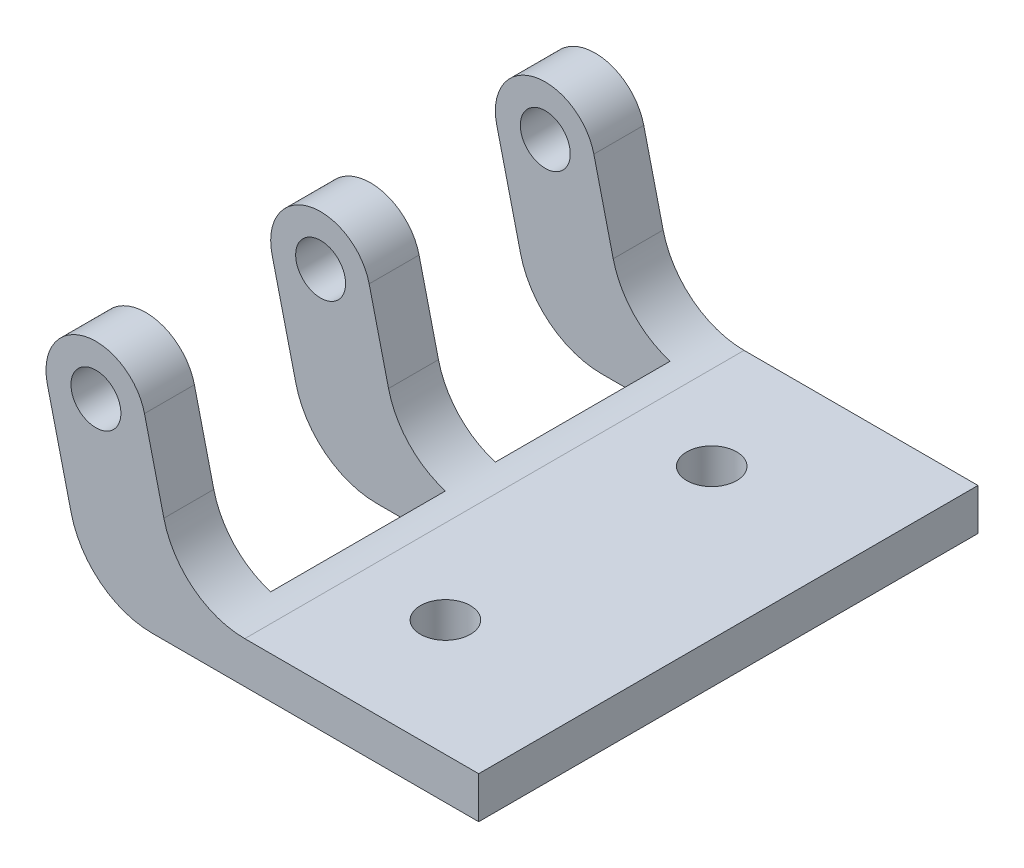
from build123d import *

# Parameters (mm, degrees)
ESBO_O1_R                  = 1.5
RESSALTO_EXTRUS_O1_DEPTH   = 30
FILETE1_R                  = 5
CORTE_EXTRUS_O1_DEPTH      = 37.193922142
CORTE_EXTRUS_O1_DEPTH_BACK = 37.193922142
ESBO_O2_R                  = 1.5
ESBO_O2_W                  = 10.5
ESBO_O2_H                  = 10.5


with BuildPart() as part:
    # Esboço1 → Ressalto-extrusão1 (new body)
    with BuildSketch(Plane.XY):
        with BuildLine():
            Line((-9, 0), (9, 0))
            Line((9, 0), (9, -2.5))
            Line((9, -2.5), (-14.571038018, -2.5))
            Line((-14.571038018, -2.5), (-16.91755647, 7.301527206))
            ThreePointArc((-16.91755647, 7.301527206), (-14.698472794, 10.91755647), (-11.08244353, 8.698472794))
            Line((-11.08244353, 8.698472794), (-9, 0))
        make_face()
        with Locations((-14, 8)):
            Circle(ESBO_O1_R, mode=Mode.SUBTRACT)
    extrude(amount=RESSALTO_EXTRUS_O1_DEPTH)

    # Filete1
    filete1_edges = [part.edges().sort_by_distance(p)[0] for p in [
        (-14.571038018, -2.5, 15),
        (-9, 0, 15),
    ]]
    fillet(filete1_edges, radius=FILETE1_R)

    # Esboço2 → Corte-extrusão1 (cut, two sides: drawn at the far end of the back side and taken through both)
    with BuildSketch(Plane(origin=(0, 0, 0), x_dir=(1, 0, 0), z_dir=(0, 1, 0)).offset(-CORTE_EXTRUS_O1_DEPTH_BACK)):
        with Locations((0, -7)):
            Circle(ESBO_O2_R)
        with Locations((0, -23)):
            Circle(ESBO_O2_R)
        with Locations((-11.75, -8.25)):
            Rectangle(ESBO_O2_W, ESBO_O2_H)
        with Locations((-11.75, -21.75)):
            Rectangle(ESBO_O2_W, ESBO_O2_H)
    extrude(amount=CORTE_EXTRUS_O1_DEPTH + CORTE_EXTRUS_O1_DEPTH_BACK, mode=Mode.SUBTRACT)


solid = part.part
